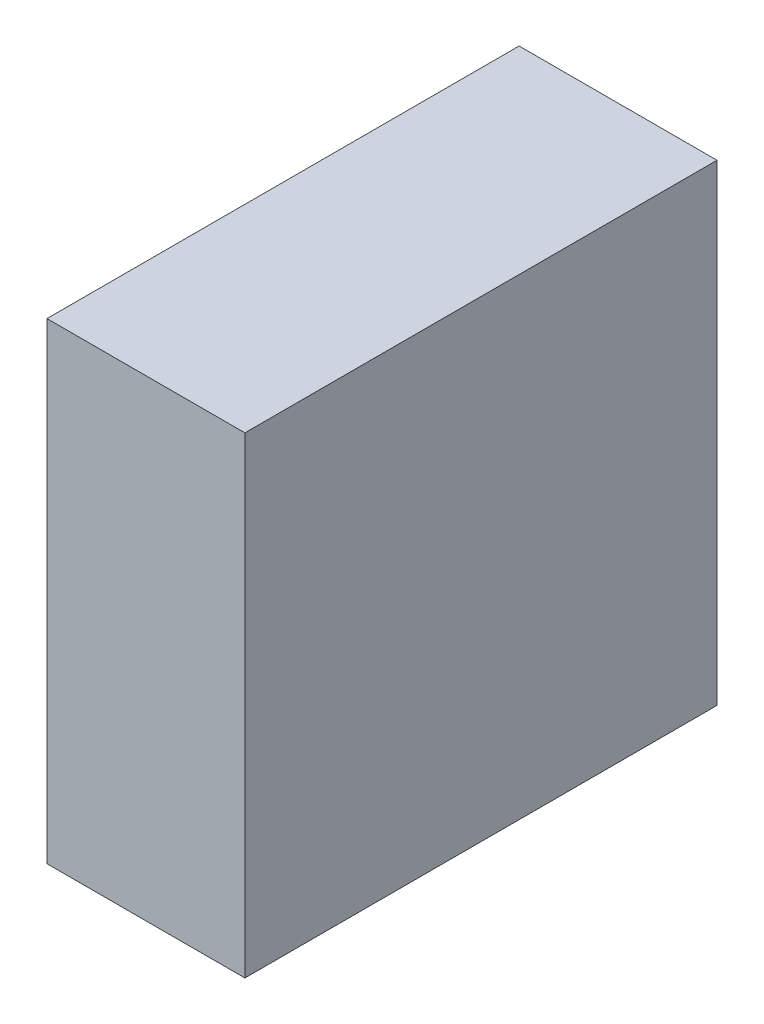
from build123d import *

# Parameters (mm, degrees)
SKETCH1_W           = 12
SKETCH1_H           = 12
BOSS_EXTRUDE1_DEPTH = 5.03


with BuildPart() as part:
    # Sketch1 → Boss-Extrude1 (new body)
    with BuildSketch(Plane(origin=(0, 0, 0), x_dir=(0, 0, -1), z_dir=(1, 0, 0))):
        with Locations((6, 6)):
            Rectangle(SKETCH1_W, SKETCH1_H)
    extrude(amount=BOSS_EXTRUDE1_DEPTH)


solid = part.part
